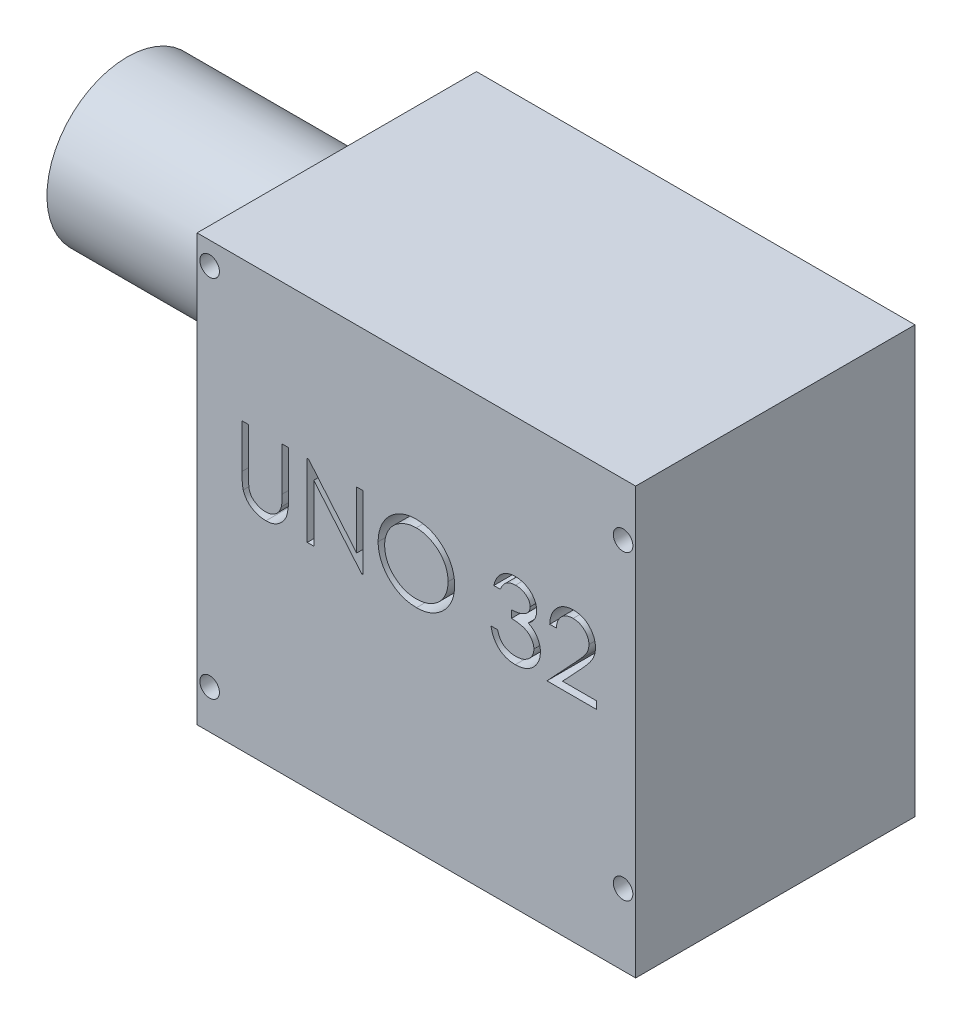
from build123d import *

# Parameters (mm, degrees)
SKETCH1_W           = 79.756
SKETCH1_H           = 77.47
SKETCH1_R           = 1.778
BOSS_EXTRUDE1_DEPTH = 50.8
CUT_EXTRUDE2_DEPTH  = 113.764424224
SKETCH3_R           = 14.599831798
BOSS_EXTRUDE2_DEPTH = 38.1


with BuildPart() as part:
    # Sketch1 → Boss-Extrude1 (new body)
    with BuildSketch(Plane.XY):
        with Locations((-46.331875823, 13.255698024)):
            Rectangle(SKETCH1_W, SKETCH1_H)
        with Locations((-8.739875823, 42.338698024)):
            Circle(SKETCH1_R, mode=Mode.SUBTRACT)
        with Locations((-8.739875823, -12.525301976)):
            Circle(SKETCH1_R, mode=Mode.SUBTRACT)
        with Locations((-83.923875823, 47.926698024)):
            Circle(SKETCH1_R, mode=Mode.SUBTRACT)
        with Locations((-83.923875823, -18.367301976)):
            Circle(SKETCH1_R, mode=Mode.SUBTRACT)
    extrude(amount=BOSS_EXTRUDE1_DEPTH)

    # Sketch2 → Cut-Extrude2 (cut, through all)
    # profile 1 of 5: a face of its own
    with BuildSketch(Plane.XY.offset(50.8)):
        with BuildLine():
            Line((-78.047954883, 26.484864691), (-76.860721977, 26.484864691))
            Line((-76.860721977, 26.484864691), (-76.860721977, 18.558494999))
            add(Edge.make_bspline(
                [(-76.860721977, 18.558494999), (-76.860898658, 18.446308885), (-76.861233941, 18.2334164), (-76.85899438, 17.930399312), (-76.852722362, 17.661006386), (-76.848768128, 17.424199209), (-76.839971362, 17.22106442), (-76.832797196, 17.05050149), (-76.823572473, 16.913318046), (-76.812485987, 16.833259188), (-76.807720508, 16.798846228)],
                knots=[0, 0, 0, 0, 1.528628734, 2.90083645, 4.128790002, 5.200304208, 6.127813768, 6.898992206, 7.526736466, 8, 8, 8, 8], degree=3))
            add(Edge.make_bspline(
                [(-76.807720508, 16.798846228), (-76.788150947, 16.674693283), (-76.750114498, 16.433382967), (-76.653177297, 16.089771307), (-76.517795671, 15.780089902), (-76.357371075, 15.494675201), (-76.145959121, 15.241471369), (-75.892701711, 15.008216015), (-75.585869074, 14.804215444), (-75.244705475, 14.617681126), (-74.87699044, 14.467756558), (-74.501239523, 14.354388782), (-74.123100882, 14.285298893), (-73.869946924, 14.27729888), (-73.744235599, 14.273326229)],
                knots=[0, 0, 0, 0, 1.035780045, 2.013197591, 2.933192213, 3.817615948, 4.702609284, 5.640816605, 6.646850145, 7.73207398, 8.84249596, 9.914020372, 10.964143139, 12, 12, 12, 12], degree=3))
            add(Edge.make_bspline(
                [(-73.744235599, 14.273326229), (-73.636309259, 14.277385127), (-73.421079933, 14.285479481), (-73.101287769, 14.335604533), (-72.789834977, 14.425942981), (-72.485183598, 14.542509925), (-72.199618865, 14.696526117), (-71.93298145, 14.874442683), (-71.69499277, 15.083126649), (-71.477815219, 15.314071404), (-71.288695075, 15.574647433), (-71.124762486, 15.859180872), (-70.99048293, 16.171953701), (-70.924172584, 16.39176357), (-70.890106492, 16.504688075)],
                knots=[0, 0, 0, 0, 0.994687771, 1.983630487, 2.973142513, 3.978332533, 4.983357753, 5.956394766, 6.925816176, 7.893390482, 8.871859704, 9.88551698, 10.913711441, 12, 12, 12, 12], degree=3))
            add(Edge.make_bspline(
                [(-70.890106492, 16.504688075), (-70.878766733, 16.551362746), (-70.853497179, 16.655372722), (-70.829884837, 16.831212124), (-70.80529172, 17.038680851), (-70.78822772, 17.279269548), (-70.771592155, 17.552172034), (-70.761639767, 17.858809971), (-70.757039672, 18.198069912), (-70.755668827, 18.43482347), (-70.754952746, 18.558494999)],
                knots=[0, 0, 0, 0, 0.558680831, 1.244966039, 2.062412453, 2.990489873, 4.051219941, 5.244515665, 6.560634259, 8, 8, 8, 8], degree=3))
            Line((-70.754952746, 18.558494999), (-70.754952746, 26.484864691))
            Line((-70.754952746, 26.484864691), (-69.56771984, 26.484864691))
            Line((-69.56771984, 26.484864691), (-69.56771984, 18.494893236))
            add(Edge.make_bspline(
                [(-69.56771984, 18.494893236), (-69.568680355, 18.350890435), (-69.570554858, 18.069860213), (-69.586810013, 17.658050016), (-69.61272784, 17.267400355), (-69.649346505, 16.897858716), (-69.697867321, 16.55074746), (-69.751824256, 16.22302408), (-69.820538562, 15.917041042), (-69.900795763, 15.630412559), (-69.992543995, 15.357568505), (-70.11138405, 15.098622253), (-70.245280225, 14.845701755), (-70.40408561, 14.602632415), (-70.582533395, 14.368338002), (-70.784568022, 14.144239415), (-71.003507559, 13.92675552), (-71.242991608, 13.721465062), (-71.499072463, 13.533200122), (-71.770988374, 13.367654976), (-72.056650569, 13.227714517), (-72.355316492, 13.112522779), (-72.667113599, 13.02591105), (-72.99204975, 12.961371026), (-73.330864558, 12.924698652), (-73.561296443, 12.919248499), (-73.677983763, 12.916488622)],
                knots=[0, 0, 0, 0, 1.316592851, 2.569410997, 3.76748051, 4.895814652, 5.963796859, 6.97159953, 7.931736103, 8.829262218, 9.692595152, 10.560224239, 11.431080259, 12.30701507, 13.211635791, 14.121146779, 15.063487852, 16.031507147, 17.00238618, 17.966455255, 18.938106653, 19.907068911, 20.888905087, 21.893141452, 22.933117798, 24, 24, 24, 24], degree=3))
            add(Edge.make_bspline(
                [(-73.677983763, 12.916488622), (-73.805244954, 12.919454848), (-74.054930956, 12.925274573), (-74.422845675, 12.958622467), (-74.775551119, 13.021436041), (-75.11677244, 13.10141559), (-75.441864081, 13.211723169), (-75.755181564, 13.340605962), (-76.051358722, 13.498892035), (-76.335200429, 13.675003967), (-76.599121382, 13.873156617), (-76.841394304, 14.08913287), (-77.062419172, 14.319472987), (-77.258470495, 14.566670798), (-77.432796457, 14.828803738), (-77.582967205, 15.106613365), (-77.711907145, 15.39999212), (-77.778455777, 15.603922371), (-77.812098346, 15.707015966)],
                knots=[0, 0, 0, 0, 1.13879206, 2.234305948, 3.301075583, 4.341971843, 5.366689343, 6.369221514, 7.369726634, 8.367512178, 9.355451585, 10.318319045, 11.268648973, 12.207971039, 13.137398894, 14.081662264, 15.030215811, 16, 16, 16, 16], degree=3))
            add(Edge.make_bspline(
                [(-77.812098346, 15.707015966), (-77.831666771, 15.777442661), (-77.874111121, 15.930199731), (-77.919563883, 16.183014733), (-77.957773805, 16.474112784), (-77.993702552, 16.803513812), (-78.014903078, 17.171473129), (-78.033489825, 17.577831234), (-78.048085825, 18.023079482), (-78.04799975, 18.333226014), (-78.047954883, 18.494893236)],
                knots=[0, 0, 0, 0, 0.625038921, 1.35572334, 2.194682327, 3.136881307, 4.189498639, 5.346923369, 6.617055217, 8, 8, 8, 8], degree=3))
            Line((-78.047954883, 18.494893236), (-78.047954883, 26.484864691))
        make_face()
    # profile 2 of 5: a face of its own
    with BuildSketch(Plane.XY.offset(50.8)):
        Polygon((-66.175625823, 13.255698024), (-66.175625823, 26.484864691), (-65.926518919, 26.484864691), (-57.186576678, 16.072726102), (-57.186576678, 26.484864691), (-55.999343772, 26.484864691), (-55.999343772, 13.255698024), (-56.269651264, 13.255698024), (-64.988392917, 23.643985951), (-64.988392917, 13.255698024), align=None)
    # profile 3 of 5: a face of its own
    with BuildSketch(Plane.XY.offset(50.8)):
        with BuildLine():
            add(Edge.make_bspline(
                [(-46.416678174, 26.824074092), (-46.171718964, 26.817869691), (-45.690598866, 26.805683735), (-44.983500294, 26.7124026), (-44.308453356, 26.551024191), (-43.659959082, 26.336095656), (-43.045774319, 26.04938414), (-42.461276124, 25.702836109), (-41.907855202, 25.292820923), (-41.392970814, 24.822508071), (-40.921797222, 24.31079085), (-40.506681521, 23.764698749), (-40.158783565, 23.187533633), (-39.873087287, 22.581029899), (-39.648952661, 21.946559186), (-39.494288418, 21.280738997), (-39.395492434, 20.587883353), (-39.383942323, 20.115311573), (-39.378083088, 19.875581504)],
                knots=[0, 0, 0, 0, 1.065120563, 2.091984664, 3.0946048, 4.079830382, 5.057816894, 6.036188127, 7.030412546, 8.04752943, 9.064399622, 10.05169764, 11.02544977, 11.989514704, 12.962713494, 13.945757189, 14.957906945, 16, 16, 16, 16], degree=3))
            add(Edge.make_bspline(
                [(-39.378083088, 19.875581504), (-39.383941464, 19.637617347), (-39.395489002, 19.168562424), (-39.49440075, 18.480103573), (-39.649525958, 17.818302428), (-39.871005893, 17.1842638), (-40.155340291, 16.577318842), (-40.505554777, 15.999064582), (-40.918082568, 15.449311448), (-41.387554891, 14.934082029), (-41.899338592, 14.461621351), (-42.448274422, 14.049933934), (-43.02201703, 13.695679058), (-43.627949558, 13.413014576), (-44.258036006, 13.187090949), (-44.917915621, 13.03305571), (-45.604496346, 12.933696945), (-46.072699247, 12.922287674), (-46.310675236, 12.916488622)],
                knots=[0, 0, 0, 0, 1.043624062, 2.057103931, 3.04512605, 4.022047818, 4.998200453, 5.980619268, 6.982898556, 8.009068085, 9.034988726, 10.034168286, 11.015286542, 11.987931943, 12.962482838, 13.94673481, 14.956375938, 16, 16, 16, 16], degree=3))
            add(Edge.make_bspline(
                [(-46.310675236, 12.916488622), (-46.55040406, 12.922344936), (-47.022973389, 12.933889288), (-47.716699683, 13.032848765), (-48.382987584, 13.187597145), (-49.019931709, 13.408748883), (-49.627887246, 13.694564011), (-50.208043214, 14.043074611), (-50.758070943, 14.456607555), (-51.273410282, 14.925927644), (-51.744932549, 15.436843927), (-52.156017094, 15.984282926), (-52.504606064, 16.557504444), (-52.789461517, 17.158099252), (-53.014978968, 17.783163932), (-53.168833489, 18.436867998), (-53.268377117, 19.115484583), (-53.279848114, 19.577533633), (-53.285668558, 19.811979741)],
                knots=[0, 0, 0, 0, 1.053102029, 2.075944431, 3.073151272, 4.055350789, 5.033113405, 6.020478099, 7.024410459, 8.052272461, 9.079885166, 10.07527673, 11.055994387, 12.023226415, 12.992069828, 13.970394897, 14.97016774, 16, 16, 16, 16], degree=3))
            add(Edge.make_bspline(
                [(-53.285668558, 19.811979741), (-53.283647763, 19.969341318), (-53.279631667, 20.282079285), (-53.231282115, 20.74648578), (-53.161123304, 21.203423682), (-53.060574408, 21.651593635), (-52.929070191, 22.089898547), (-52.773903302, 22.521361252), (-52.584386624, 22.941609255), (-52.37014727, 23.352633385), (-52.131032698, 23.748026362), (-51.866919002, 24.121767644), (-51.587082937, 24.476993435), (-51.280304633, 24.804498479), (-50.956694855, 25.113810216), (-50.611003962, 25.400175248), (-50.245341312, 25.666175807), (-49.858133508, 25.905889596), (-49.458921576, 26.122693468), (-49.047393279, 26.308740345), (-48.629137785, 26.468420399), (-48.20219611, 26.597842565), (-47.767702001, 26.700017225), (-47.324707161, 26.76959264), (-46.873564508, 26.818065508), (-46.569628868, 26.822062614), (-46.416678174, 26.824074092)],
                knots=[0, 0, 0, 0, 1.037015668, 2.060948919, 3.074880161, 4.083647147, 5.086022904, 6.090072063, 7.104153813, 8.122640571, 9.144368836, 10.147691507, 11.138137339, 12.123020368, 13.103399296, 14.087645067, 15.080126199, 16.082011238, 17.087798457, 18.072939717, 19.057185487, 20.037253025, 21.01195951, 21.997135196, 22.992090687, 24, 24, 24, 24], degree=3))
        make_face()
        with BuildLine():
            add(Edge.make_bspline(
                [(-46.358376558, 25.467236486), (-46.483919964, 25.465706097), (-46.733806574, 25.46265995), (-47.10529872, 25.422535073), (-47.471905137, 25.365347695), (-47.833701535, 25.283774685), (-48.189174117, 25.172634366), (-48.541636314, 25.04472379), (-48.887874048, 24.888917883), (-49.226744284, 24.712884149), (-49.555262574, 24.518041502), (-49.865251059, 24.302701787), (-50.157512243, 24.07191499), (-50.431330543, 23.825142509), (-50.685901937, 23.561127645), (-50.92623697, 23.283872902), (-51.142702353, 22.985453551), (-51.341085336, 22.673961835), (-51.51861259, 22.349803478), (-51.676475687, 22.0163912), (-51.805607506, 21.671005301), (-51.910920654, 21.31739286), (-51.998232439, 20.95611392), (-52.053545188, 20.584427825), (-52.094110951, 20.204202253), (-52.096982986, 19.947247031), (-52.098435652, 19.817279888)],
                knots=[0, 0, 0, 0, 1.008559885, 2.007477868, 2.99961109, 3.989939068, 4.984837346, 5.991145699, 7.001802488, 8.033829008, 9.059044045, 10.069351652, 11.065060232, 12.050310815, 13.029377138, 14.011219647, 14.996725999, 15.989392538, 16.977580475, 17.965360261, 18.951710183, 19.937753436, 20.929683414, 21.935841486, 22.955955122, 24, 24, 24, 24], degree=3))
            add(Edge.make_bspline(
                [(-52.098435652, 19.817279888), (-52.093616978, 19.626166732), (-52.084137154, 19.250188032), (-52.001142767, 18.699219154), (-51.873303756, 18.169718786), (-51.684854782, 17.664584189), (-51.449184304, 17.179473358), (-51.158040998, 16.718689748), (-50.813103383, 16.282108824), (-50.421279935, 15.872778492), (-49.992947085, 15.499164886), (-49.538118017, 15.17121986), (-49.061665393, 14.893746594), (-48.56234674, 14.66769766), (-48.042827768, 14.488575734), (-47.499760834, 14.365814241), (-46.936763561, 14.28502011), (-46.553001859, 14.277261181), (-46.358376558, 14.273326229)],
                knots=[0, 0, 0, 0, 1.032063989, 2.030389145, 3.003944642, 3.970395727, 4.937377036, 5.913328081, 6.909231446, 7.93887556, 8.970685674, 9.976071282, 10.964166581, 11.944589148, 12.933237628, 13.927779006, 14.949070134, 16, 16, 16, 16], degree=3))
            add(Edge.make_bspline(
                [(-46.358376558, 14.273326229), (-46.227560882, 14.275123522), (-45.968114108, 14.278688095), (-45.582217342, 14.314590832), (-45.203272732, 14.372163671), (-44.831811793, 14.455056328), (-44.468256107, 14.558800233), (-44.11108825, 14.682049681), (-43.764112569, 14.835814945), (-43.422951873, 15.0057075), (-43.09639465, 15.199383096), (-42.784656775, 15.407414197), (-42.49559578, 15.637861067), (-42.221982325, 15.880967085), (-41.966365763, 16.14163401), (-41.730474662, 16.419522943), (-41.515103329, 16.716387928), (-41.316795676, 17.027407169), (-41.139890487, 17.352452529), (-40.985755202, 17.687073633), (-40.854990121, 18.030446517), (-40.749427022, 18.383066445), (-40.666705188, 18.744263701), (-40.609706681, 19.114521913), (-40.569836095, 19.49310038), (-40.566830892, 19.749156026), (-40.565315994, 19.878231578)],
                knots=[0, 0, 0, 0, 1.047197238, 2.076906641, 3.100256066, 4.114471768, 5.12198147, 6.126382909, 7.136867548, 8.15857795, 9.17633901, 10.174870724, 11.156907918, 12.133735059, 13.104061851, 14.077631395, 15.04955518, 16.038496417, 17.029181396, 18.010275684, 18.986308667, 19.968651475, 20.955262928, 21.950658345, 22.966943676, 24, 24, 24, 24], degree=3))
            add(Edge.make_bspline(
                [(-40.565315994, 19.878231578), (-40.566832106, 20.006424109), (-40.569839592, 20.260717608), (-40.609687636, 20.63665582), (-40.666765406, 21.004249804), (-40.749023261, 21.36205644), (-40.855046164, 21.710166937), (-40.985778038, 22.048254346), (-41.139936759, 22.377578179), (-41.316860702, 22.69732448), (-41.515735987, 23.004145662), (-41.733050538, 23.297464305), (-41.972556467, 23.571771988), (-42.227410787, 23.833840623), (-42.503979312, 24.078080861), (-42.801009233, 24.304573721), (-43.114894563, 24.518785205), (-43.447238578, 24.712027656), (-43.790229117, 24.890486214), (-44.142177708, 25.043381374), (-44.499097222, 25.173299802), (-44.860080027, 25.28411095), (-45.228164499, 25.365028206), (-45.600863495, 25.422586609), (-45.977661377, 25.462645984), (-46.231068785, 25.465701463), (-46.358376558, 25.467236486)],
                knots=[0, 0, 0, 0, 1.02996197, 2.043119294, 3.035359645, 4.018872909, 4.991431989, 5.957985074, 6.929999688, 7.912076566, 8.892894881, 9.867085534, 10.843653904, 11.817741046, 12.803660682, 13.806313499, 14.818574707, 15.856120519, 16.894564902, 17.924820532, 18.937903209, 19.946497019, 20.957711757, 21.963978472, 22.977135795, 24, 24, 24, 24], degree=3))
        make_face(mode=Mode.SUBTRACT)
    # profile 4 of 5: a face of its own
    with BuildSketch(Plane.XY.offset(50.8)):
        with BuildLine():
            Line((-31.067452746, 23.431980075), (-32.254685652, 23.431980075))
            add(Edge.make_bspline(
                [(-32.254685652, 23.431980075), (-32.222521577, 23.565150476), (-32.15964344, 23.825487717), (-32.028494874, 24.197443733), (-31.885622689, 24.549428471), (-31.714062681, 24.874851131), (-31.526931377, 25.180251745), (-31.312532995, 25.458703495), (-31.080759044, 25.717288216), (-30.824396885, 25.946769799), (-30.555547479, 26.154572525), (-30.270422577, 26.331749081), (-29.974758663, 26.484164778), (-29.666507238, 26.609729345), (-29.344750577, 26.704319866), (-29.012397537, 26.772948268), (-28.668577164, 26.817515872), (-28.435185974, 26.821865483), (-28.316676504, 26.824074092)],
                knots=[0, 0, 0, 0, 1.162005537, 2.271625781, 3.343758855, 4.383309926, 5.390229558, 6.379919256, 7.361854164, 8.333198761, 9.295911338, 10.242430842, 11.177959212, 12.116337295, 13.062827104, 14.020064771, 14.994644689, 16, 16, 16, 16], degree=3))
            add(Edge.make_bspline(
                [(-28.316676504, 26.824074092), (-28.144006616, 26.81886093), (-27.802433271, 26.808548321), (-27.300620564, 26.714377683), (-26.81670967, 26.565360069), (-26.355997335, 26.359462351), (-25.928058617, 26.105510304), (-25.547299815, 25.803262638), (-25.218881932, 25.458550992), (-24.943358541, 25.077805883), (-24.727628633, 24.67089369), (-24.568552162, 24.252095477), (-24.471708308, 23.822404692), (-24.459157394, 23.532280452), (-24.452869413, 23.386928827)],
                knots=[0, 0, 0, 0, 1.083050992, 2.142477498, 3.193116406, 4.255571735, 5.30263384, 6.308962982, 7.297363603, 8.282367274, 9.249857812, 10.179914175, 11.08814088, 12, 12, 12, 12], degree=3))
            add(Edge.make_bspline(
                [(-24.452869413, 23.386928827), (-24.45726751, 23.247051954), (-24.465873904, 22.97333462), (-24.538950708, 22.573732533), (-24.661930034, 22.197111008), (-24.832283006, 21.841884591), (-25.052800175, 21.510305584), (-25.319926143, 21.20162796), (-25.635546322, 20.914482631), (-25.874725642, 20.749989385), (-25.997862235, 20.665303393)],
                knots=[0, 0, 0, 0, 1.024540389, 2.004866551, 2.965041327, 3.920577974, 4.882998113, 5.874504559, 6.905732034, 8, 8, 8, 8], degree=3))
            add(Edge.make_bspline(
                [(-25.997862235, 20.665303393), (-25.857135067, 20.597350185), (-25.578313846, 20.462715226), (-25.198256785, 20.198677095), (-24.853248149, 19.893815306), (-24.660844211, 19.655907064), (-24.564172498, 19.536372102)],
                knots=[0, 0, 0, 0, 1.015518401, 2.012035669, 3.001164323, 4, 4, 4, 4], degree=3))
            add(Edge.make_bspline(
                [(-24.564172498, 19.536372102), (-24.500516234, 19.449219291), (-24.374246121, 19.276340857), (-24.218385621, 18.998390676), (-24.076988076, 18.717359749), (-23.966807187, 18.425715565), (-23.881483345, 18.1268384), (-23.820492986, 17.820215058), (-23.78260412, 17.505595152), (-23.777178075, 17.292747384), (-23.77445061, 17.185756952)],
                knots=[0, 0, 0, 0, 1.025084078, 2.033381695, 3.024893161, 4.013698104, 4.991890475, 5.976764909, 6.982997093, 8, 8, 8, 8], degree=3))
            add(Edge.make_bspline(
                [(-23.77445061, 17.185756952), (-23.781233444, 17.000511874), (-23.794767191, 16.630893487), (-23.915734972, 16.084813438), (-24.103261209, 15.551014664), (-24.369571652, 15.040463932), (-24.69413039, 14.562776183), (-25.080260753, 14.135374658), (-25.523575451, 13.767987076), (-26.017989659, 13.461031749), (-26.553646663, 13.21565746), (-27.126566311, 13.045351054), (-27.728493599, 12.934430163), (-28.141271182, 12.922535747), (-28.351127459, 12.916488622)],
                knots=[0, 0, 0, 0, 0.955779014, 1.907060117, 2.875433937, 3.871313158, 4.872415639, 5.851225146, 6.836215519, 7.83643374, 8.849228613, 9.86973379, 10.916971861, 12, 12, 12, 12], degree=3))
            add(Edge.make_bspline(
                [(-28.351127459, 12.916488622), (-28.492563505, 12.919770262), (-28.77086248, 12.926227434), (-29.179997131, 12.970369766), (-29.570528554, 13.050992107), (-29.942984772, 13.159483767), (-30.297696666, 13.297035887), (-30.633581825, 13.468329776), (-30.952706721, 13.66983456), (-31.252059899, 13.903928776), (-31.531605676, 14.165795745), (-31.78391508, 14.460084265), (-32.013194654, 14.781354214), (-32.213305223, 15.133337194), (-32.393361562, 15.511484446), (-32.541456249, 15.920637997), (-32.671803488, 16.357140104), (-32.732406165, 16.6613268), (-32.763499755, 16.817396742)],
                knots=[0, 0, 0, 0, 1.048658725, 2.063410685, 3.046034179, 4.001477787, 4.936774919, 5.862367409, 6.792675028, 7.730719943, 8.675894397, 9.627829632, 10.600096036, 11.597688215, 12.626045268, 13.701542398, 14.82072376, 16, 16, 16, 16], degree=3))
            Line((-32.763499755, 16.817396742), (-31.576266849, 16.817396742))
            add(Edge.make_bspline(
                [(-31.576266849, 16.817396742), (-31.545335956, 16.715535888), (-31.485172682, 16.51740768), (-31.382762686, 16.232261287), (-31.266087967, 15.970860312), (-31.14092282, 15.731287202), (-31.009468575, 15.511182585), (-30.862379423, 15.316366592), (-30.710549619, 15.138282346), (-30.596100872, 15.037950033), (-30.54008813, 14.988846061)],
                knots=[0, 0, 0, 0, 1.198163088, 2.33053128, 3.407730985, 4.417276592, 5.372219308, 6.28897303, 7.162600585, 8, 8, 8, 8], degree=3))
            add(Edge.make_bspline(
                [(-30.54008813, 14.988846061), (-30.466017736, 14.931740156), (-30.318105588, 14.817704619), (-30.077076857, 14.67217763), (-29.823587556, 14.546080898), (-29.552145186, 14.449758595), (-29.268607214, 14.368200175), (-28.968390685, 14.314827975), (-28.654144239, 14.278208994), (-28.439575609, 14.274977556), (-28.329926872, 14.273326229)],
                knots=[0, 0, 0, 0, 0.946170439, 1.889420265, 2.845303464, 3.807233317, 4.801018734, 5.828864929, 6.890507805, 8, 8, 8, 8], degree=3))
            add(Edge.make_bspline(
                [(-28.329926872, 14.273326229), (-28.20612643, 14.275654204), (-27.964045354, 14.280206359), (-27.610808237, 14.322069894), (-27.274759254, 14.383039016), (-26.959629445, 14.477204159), (-26.66129092, 14.593548449), (-26.383925756, 14.73963022), (-26.123892855, 14.911022471), (-25.884522781, 15.105828219), (-25.669282321, 15.319088037), (-25.479766899, 15.542143395), (-25.318655827, 15.774053822), (-25.188694088, 16.016102672), (-25.086071472, 16.267287615), (-25.016209375, 16.528313547), (-24.967633708, 16.797044285), (-24.963677763, 16.979716281), (-24.961683516, 17.071803793)],
                knots=[0, 0, 0, 0, 1.217147791, 2.380027433, 3.494444702, 4.572153297, 5.609568379, 6.639424714, 7.649109417, 8.668170816, 9.669597737, 10.625200337, 11.543417969, 12.441394052, 13.322311151, 14.205496177, 15.095365482, 16, 16, 16, 16], degree=3))
            add(Edge.make_bspline(
                [(-24.961683516, 17.071803793), (-24.967467691, 17.19506689), (-24.979007261, 17.440979742), (-25.067108141, 17.802769383), (-25.21201992, 18.151351924), (-25.414889233, 18.480780059), (-25.661842731, 18.786093735), (-25.950483897, 19.058506778), (-26.283209641, 19.283289563), (-26.589445456, 19.438594901), (-26.860700661, 19.54456837), (-27.092836191, 19.615155289), (-27.352719781, 19.674927143), (-27.637208659, 19.730536026), (-27.948446412, 19.777863741), (-28.286094198, 19.817331318), (-28.65022044, 19.848911384), (-28.902297168, 19.863014035), (-29.032196336, 19.870281357)],
                knots=[0, 0, 0, 0, 1.07054697, 2.135767047, 3.216561865, 4.33974944, 5.486079747, 6.621378074, 7.775625952, 8.963672916, 9.598146892, 10.304877434, 11.070270905, 11.915000392, 12.823868403, 13.805723172, 14.86925407, 16, 16, 16, 16], degree=3))
            Line((-29.032196336, 19.870281357), (-29.032196336, 21.227118964))
            add(Edge.make_bspline(
                [(-29.032196336, 21.227118964), (-28.86852824, 21.229896347), (-28.547942644, 21.235336558), (-28.079651671, 21.301134693), (-27.631850759, 21.392153734), (-27.214463966, 21.531570978), (-26.834035793, 21.6934971), (-26.503988488, 21.881926583), (-26.228945997, 22.091381141), (-26.010244923, 22.325093682), (-25.845714803, 22.575748772), (-25.725417086, 22.836993282), (-25.654356329, 23.111116965), (-25.644870386, 23.298195025), (-25.640102319, 23.392228973)],
                knots=[0, 0, 0, 0, 1.321986639, 2.589447074, 3.816329219, 5.01088745, 6.139805852, 7.153945165, 8.075214402, 8.924034688, 9.728124013, 10.488707548, 11.240355623, 12, 12, 12, 12], degree=3))
            add(Edge.make_bspline(
                [(-25.640102319, 23.392228973), (-25.641668694, 23.461314498), (-25.644784922, 23.598756873), (-25.684084157, 23.799556984), (-25.743139312, 23.994218298), (-25.824327574, 24.181912997), (-25.93299648, 24.36133933), (-26.063042917, 24.534027009), (-26.217892582, 24.698990102), (-26.395335194, 24.852752024), (-26.585879814, 24.99929051), (-26.794710809, 25.123696221), (-27.015531585, 25.230077855), (-27.24858662, 25.317804247), (-27.494632226, 25.383796199), (-27.752512369, 25.431178695), (-28.022718792, 25.460803164), (-28.207064327, 25.465068307), (-28.300776064, 25.467236486)],
                knots=[0, 0, 0, 0, 0.884392785, 1.759457502, 2.611959086, 3.489218968, 4.37281399, 5.2945488, 6.255912374, 7.266815255, 8.301784654, 9.332968512, 10.37626691, 11.440494194, 12.520033166, 13.637162961, 14.798855837, 16, 16, 16, 16], degree=3))
            add(Edge.make_bspline(
                [(-28.300776064, 25.467236486), (-28.45140588, 25.461977468), (-28.745620946, 25.451705385), (-29.169766614, 25.361735661), (-29.564068858, 25.218187548), (-29.865462033, 25.046839528), (-30.088024143, 24.877693543), (-30.247064952, 24.729971428), (-30.403246643, 24.565805696), (-30.54629429, 24.375085051), (-30.690960809, 24.170725457), (-30.822664955, 23.942338328), (-30.95064653, 23.695881242), (-31.02776331, 23.521650719), (-31.067452746, 23.431980075)],
                knots=[0, 0, 0, 0, 1.472543308, 2.876219568, 4.221790263, 5.565193594, 6.249813518, 6.953379497, 7.687249741, 8.463570142, 9.283606569, 10.136032583, 11.040678096, 12, 12, 12, 12], degree=3))
        make_face()
    # profile 5 of 5: a face of its own
    with BuildSketch(Plane.XY.offset(50.8)):
        with BuildLine():
            Line((-20.891170695, 22.41435187), (-22.078403601, 22.41435187))
            add(Edge.make_bspline(
                [(-22.078403601, 22.41435187), (-22.07066585, 22.571857904), (-22.055469113, 22.881195563), (-21.984302663, 23.332211519), (-21.882472561, 23.763311503), (-21.738495935, 24.171034094), (-21.559689468, 24.558984348), (-21.345263472, 24.925621312), (-21.091286715, 25.26954634), (-20.803243405, 25.587571135), (-20.490397656, 25.879321775), (-20.152842468, 26.131262722), (-19.798130609, 26.344130111), (-19.427338238, 26.522085995), (-19.036281941, 26.655662198), (-18.628510425, 26.754773753), (-18.202232142, 26.814404584), (-17.911795154, 26.820814249), (-17.764084023, 26.824074092)],
                knots=[0, 0, 0, 0, 1.10065271, 2.161652631, 3.183658789, 4.190468796, 5.17591951, 6.163126047, 7.15150782, 8.156236427, 9.156009102, 10.134482811, 11.092018607, 12.041330605, 13.001268258, 13.972401359, 14.968799086, 16, 16, 16, 16], degree=3))
            add(Edge.make_bspline(
                [(-17.764084023, 26.824074092), (-17.619024041, 26.820678141), (-17.333986357, 26.814005218), (-16.917978148, 26.756700137), (-16.521944922, 26.666947454), (-16.146660804, 26.541023113), (-15.795120024, 26.37174864), (-15.464681731, 26.168406753), (-15.151412, 25.933230605), (-14.869416121, 25.656348631), (-14.610471893, 25.360762237), (-14.387079441, 25.04519784), (-14.195773733, 24.719271671), (-14.036314348, 24.380498409), (-13.918929537, 24.025688272), (-13.829809525, 23.66000688), (-13.779435074, 23.279669053), (-13.77170386, 23.022242488), (-13.767773259, 22.891365091)],
                knots=[0, 0, 0, 0, 1.111607364, 2.184268762, 3.212621178, 4.221274766, 5.211760367, 6.196651075, 7.1921475, 8.207485113, 9.220403448, 10.201281604, 11.166441695, 12.114753415, 13.065576456, 14.026450734, 14.996634279, 16, 16, 16, 16], degree=3))
            add(Edge.make_bspline(
                [(-13.767773259, 22.891365091), (-13.77417339, 22.707109883), (-13.786861337, 22.341832885), (-13.895394844, 21.805050517), (-14.064903978, 21.284980153), (-14.269001131, 20.866419517), (-14.474893999, 20.529138157), (-14.660433091, 20.251443945), (-14.877636394, 19.952444109), (-15.129665241, 19.633139887), (-15.411306156, 19.291030216), (-15.725110167, 18.926321764), (-16.073314994, 18.542782634), (-16.317708732, 18.280823962), (-16.444347445, 18.145083541)],
                knots=[0, 0, 0, 0, 1.184426356, 2.348067706, 3.509069118, 4.696110526, 5.333549288, 6.050745305, 6.844228056, 7.710549037, 8.667450064, 9.695053472, 10.805634456, 12, 12, 12, 12], degree=3))
            Line((-16.444347445, 18.145083541), (-19.754289185, 14.612535631))
            Line((-19.754289185, 14.612535631), (-13.598168558, 14.612535631))
            Line((-13.598168558, 14.612535631), (-13.598168558, 13.255698024))
            Line((-13.598168558, 13.255698024), (-22.587217704, 13.255698024))
            Line((-22.587217704, 13.255698024), (-17.456675503, 18.730749773))
            add(Edge.make_bspline(
                [(-17.456675503, 18.730749773), (-17.331762359, 18.861145158), (-17.091829775, 19.111608006), (-16.752473011, 19.477273362), (-16.447676835, 19.816505257), (-16.175468237, 20.128662747), (-15.941752309, 20.418311827), (-15.734348337, 20.67607157), (-15.568168871, 20.913268451), (-15.387816037, 21.188210652), (-15.21313819, 21.523900065), (-15.06303494, 21.934131569), (-14.971508578, 22.356433982), (-14.960528991, 22.641813706), (-14.955006165, 22.785362153)],
                knots=[0, 0, 0, 0, 1.329631726, 2.553950428, 3.673215718, 4.687767853, 5.603093632, 6.413772471, 7.123043292, 7.734684054, 8.834405432, 9.900288307, 10.943827018, 12, 12, 12, 12], degree=3))
            add(Edge.make_bspline(
                [(-14.955006165, 22.785362153), (-14.95740912, 22.875628153), (-14.962144882, 23.053525105), (-15.003940345, 23.314350445), (-15.06710208, 23.565949592), (-15.157609454, 23.809096456), (-15.277075406, 24.041346391), (-15.422495622, 24.262982105), (-15.590279492, 24.477252896), (-15.784375064, 24.678159707), (-15.997597178, 24.862163073), (-16.222849252, 25.025161848), (-16.461163634, 25.161381106), (-16.711535524, 25.273048491), (-16.973266912, 25.360645914), (-17.246864014, 25.421343521), (-17.531570861, 25.45945291), (-17.725977229, 25.464609155), (-17.825035712, 25.467236486)],
                knots=[0, 0, 0, 0, 0.991446411, 1.95395049, 2.89581595, 3.838931463, 4.798493298, 5.75982156, 6.748411868, 7.785213223, 8.824556874, 9.840280684, 10.836137867, 11.835679398, 12.848801643, 13.863922112, 14.911575587, 16, 16, 16, 16], degree=3))
            add(Edge.make_bspline(
                [(-17.825035712, 25.467236486), (-17.928490943, 25.464533834), (-18.131659935, 25.459226272), (-18.429955089, 25.422098941), (-18.714517403, 25.358047699), (-18.986062691, 25.270445388), (-19.245050411, 25.159099087), (-19.490221054, 25.020413029), (-19.721024237, 24.854921849), (-19.937893834, 24.667292365), (-20.137707088, 24.458393992), (-20.31326522, 24.225523), (-20.466663131, 23.972931282), (-20.600501602, 23.701300391), (-20.709191264, 23.408165568), (-20.792244541, 23.094567398), (-20.857962682, 22.761867533), (-20.879917507, 22.532114385), (-20.891170695, 22.41435187)],
                knots=[0, 0, 0, 0, 1.031018746, 2.02475058, 2.990194455, 3.934040569, 4.864654155, 5.795059489, 6.735614925, 7.690564532, 8.649604399, 9.611025574, 10.590972636, 11.591080095, 12.624614302, 13.701020113, 14.821632451, 16, 16, 16, 16], degree=3))
        make_face()
    extrude(amount=-CUT_EXTRUDE2_DEPTH, mode=Mode.SUBTRACT)


with BuildPart() as cut_extrude2_piece_1:
    # of the separate pieces the step leaves, piece 1, a body of its own (cut_extrude2_pieces)
    add(part.part.solids().sort_by_distance((-86.209875823, 51.990698024, 0))[0])

    # Sketch3 → Boss-Extrude2 (add)
    with BuildSketch(Plane.ZY.offset(86.209875823)):
        with Locations((25.4, 33.352132318)):
            Circle(SKETCH3_R)
    extrude(amount=BOSS_EXTRUDE2_DEPTH)


with BuildPart() as cut_extrude2_piece_2:
    # of the separate pieces the step leaves, piece 2, a body of its own (cut_extrude2_pieces)
    add(part.part.solids().sort_by_distance((-46.358376558, 14.273326229, 0))[0])


solid = Compound([cut_extrude2_piece_1.part, cut_extrude2_piece_2.part])
